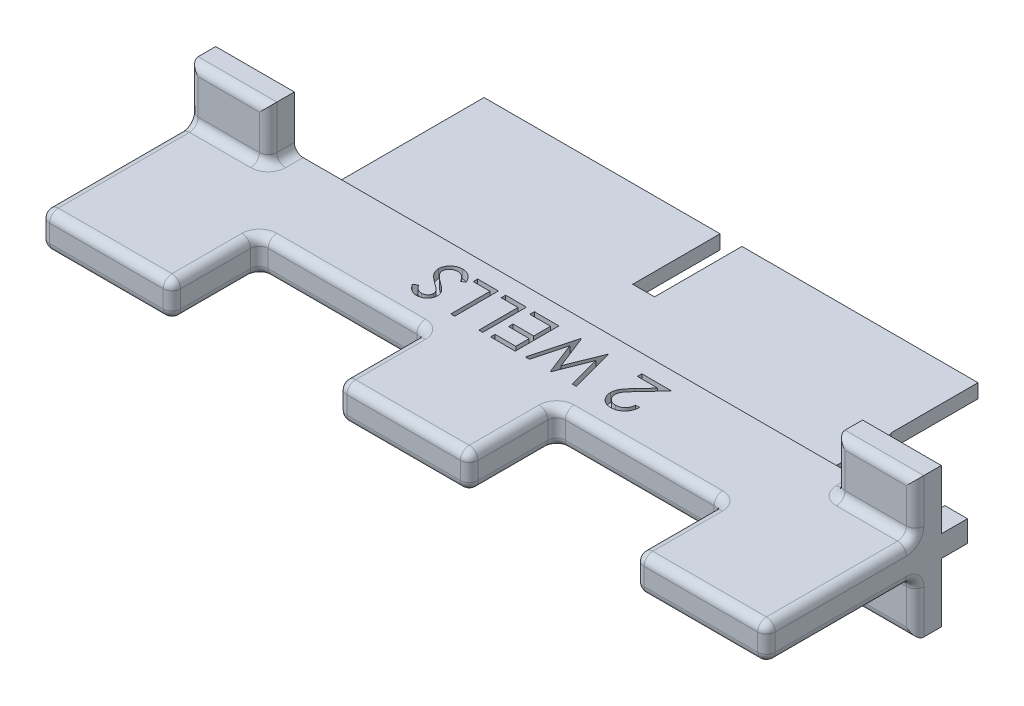
from build123d import *

# Parameters (mm, degrees)
SKETCH1_W           = 83
SKETCH1_H           = 4
BOSS_EXTRUDE1_DEPTH = 10
SKETCH2_W           = 15
SKETCH2_H           = 4
BOSS_EXTRUDE2_DEPTH = 10
SKETCH3_W           = 2.6
SKETCH3_H           = 2.45
BOSS_EXTRUDE3_DEPTH = 3
SKETCH4_W           = 56.6
SKETCH4_H           = 1.6
BOSS_EXTRUDE4_DEPTH = 7.5
SKETCH5_W           = 27
SKETCH5_H           = 1.6
BOSS_EXTRUDE5_DEPTH = 10
SKETCH6_W           = 9
SKETCH6_H           = 6
BOSS_EXTRUDE6_DEPTH = 3
FILLET1_R           = 1
CUT_EXTRUDE1_DEPTH  = 1


with BuildPart() as part:
    # Sketch1 → Boss-Extrude1 (new body)
    with BuildSketch(Plane.XY):
        Rectangle(SKETCH1_W, SKETCH1_H)
    extrude(amount=BOSS_EXTRUDE1_DEPTH)

    # Sketch2 → Boss-Extrude2 (add)
    with BuildSketch(Plane.XY.offset(10)):
        with Locations((-34, 0)):
            Rectangle(SKETCH2_W, SKETCH2_H)
        with Locations((34, 0)):
            Rectangle(SKETCH2_W, SKETCH2_H)
        Rectangle(SKETCH2_W, SKETCH2_H)
    extrude(amount=BOSS_EXTRUDE2_DEPTH)

    # Sketch3 → Boss-Extrude3 (add)
    with BuildSketch(Plane(origin=(0, 0, 0), x_dir=(-1, 0, 0), z_dir=(0, 0, -1))):
        with Locations((40.2, 0)):
            Rectangle(SKETCH3_W, SKETCH3_H)
        with Locations((-40.2, 0)):
            Rectangle(SKETCH3_W, SKETCH3_H)
    extrude(amount=BOSS_EXTRUDE3_DEPTH)

    # Sketch4 → Boss-Extrude4 (add)
    with BuildSketch(Plane(origin=(0, 0, 0), x_dir=(-1, 0, 0), z_dir=(0, 0, -1))):
        Rectangle(SKETCH4_W, SKETCH4_H)
    extrude(amount=BOSS_EXTRUDE4_DEPTH)

    # Sketch5 → Boss-Extrude5 (add)
    with BuildSketch(Plane(origin=(0, 0, -7.5), x_dir=(-1, 0, 0), z_dir=(0, 0, -1))):
        with Locations((14.8, 0)):
            Rectangle(SKETCH5_W, SKETCH5_H)
        with Locations((-14.7, 0)):
            Rectangle(SKETCH5_W, SKETCH5_H)
    extrude(amount=BOSS_EXTRUDE5_DEPTH)

    # Sketch6 → Boss-Extrude6 (add)
    with BuildSketch(Plane(origin=(0, 0, 0), x_dir=(-1, 0, 0), z_dir=(0, 0, -1))):
        with Locations((37, -5)):
            Rectangle(SKETCH6_W, SKETCH6_H)
        with Locations((37, 5)):
            Rectangle(SKETCH6_W, SKETCH6_H)
        with Locations((-37, -5)):
            Rectangle(SKETCH6_W, SKETCH6_H)
        with Locations((-37, 5)):
            Rectangle(SKETCH6_W, SKETCH6_H)
    extrude(amount=-BOSS_EXTRUDE6_DEPTH)

    # Fillet1
    fillet1_edges = [part.edges().sort_by_distance(p)[0] for p in [
        (-41.5, -2, 11.5),
        (-32.5, -2, 1.5),
        (-37, -2, 3),
        (-32.5, -5, 3),
        (-37, -8, 3),
        (-41.5, -5, 3),
        (-26.5, 0, 20),
        (-34, -2, 20),
        (-41.5, 0, 20),
        (-34, 2, 20),
        (32.5, -2, 1.5),
        (41.5, -2, 11.5),
        (41.5, 2, 11.5),
        (32.5, 2, 1.5),
        (-32.5, 2, 1.5),
        (-41.5, 2, 11.5),
        (37, -8, 3),
        (32.5, -5, 3),
        (37, -2, 3),
        (41.5, -5, 3),
        (34, -2, 20),
        (26.5, 0, 20),
        (34, 2, 20),
        (41.5, 0, 20),
        (37, 2, 3),
        (32.5, 5, 3),
        (37, 8, 3),
        (41.5, 5, 3),
        (0, -2, 20),
        (-7.5, 0, 20),
        (0, 2, 20),
        (7.5, 0, 20),
        (-37, 8, 3),
        (-32.5, 5, 3),
        (-37, 2, 3),
        (-41.5, 5, 3),
        (26.5, 2, 15),
        (26.5, -2, 15),
        (26.5, 0, 10),
        (17, -2, 10),
        (17, 2, 10),
        (7.5, -2, 15),
        (7.5, 2, 15),
        (7.5, 0, 10),
        (-7.5, 2, 15),
        (-7.5, -2, 15),
        (-26.5, -2, 15),
        (-26.5, 2, 15),
        (-26.5, 0, 10),
        (-17, 2, 10),
        (-7.5, 0, 10),
        (-17, -2, 10),
    ]]
    fillet(fillet1_edges, radius=FILLET1_R)

    # Sketch8 → Cut-Extrude1 (cut)
    with BuildSketch(Plane(origin=(0, 2, 0), x_dir=(1, 0, 0), z_dir=(0, 1, 0))):
        with BuildLine():
            Line((12.051282051, -5.506562595), (12.5, -5.506562595))
            add(Edge.make_bspline(
                [(12.5, -5.506562595), (12.497075993, -5.566092728), (12.491333323, -5.683008325), (12.464428723, -5.853466896), (12.425967248, -6.016417351), (12.371458365, -6.170462688), (12.304144659, -6.317443109), (12.221733202, -6.455406883), (12.125980874, -6.585723285), (12.017063336, -6.705924992), (11.898877769, -6.815804382), (11.772132288, -6.911694974), (11.638129598, -6.99178619), (11.49803198, -7.059104705), (11.350219164, -7.109574069), (11.196104075, -7.147037958), (11.034990128, -7.169574394), (10.925218792, -7.17199711), (10.869391026, -7.173229261)],
                knots=[0, 0, 0, 0, 1.100776268, 2.161895295, 3.184016182, 4.190939212, 5.176500551, 6.166955529, 7.155448256, 8.160289653, 9.16017456, 10.133824356, 11.091467644, 12.04088621, 13.000931625, 13.972173743, 14.968683325, 16, 16, 16, 16], degree=3))
            add(Edge.make_bspline(
                [(10.869391026, -7.173229261), (10.814561347, -7.171956168), (10.706822988, -7.169454585), (10.54964612, -7.147648624), (10.399661693, -7.114232934), (10.258569478, -7.064716144), (10.124921472, -7.002583404), (10.000372461, -6.925313202), (9.881910718, -6.836561703), (9.77535014, -6.731874959), (9.677461393, -6.620173937), (9.593087212, -6.500878186), (9.520423504, -6.377522706), (9.460950528, -6.249143911), (9.415867368, -6.115323738), (9.382465067, -5.977345167), (9.363370506, -5.83361583), (9.360456075, -5.736317952), (9.358974359, -5.686851056)],
                knots=[0, 0, 0, 0, 1.111674182, 2.184400057, 3.212814286, 4.223731311, 5.211378316, 6.196328225, 7.191884489, 8.207283132, 9.220262353, 10.201199469, 11.166417575, 12.120932471, 13.06540007, 14.026332106, 14.996573967, 16, 16, 16, 16], degree=3))
            add(Edge.make_bspline(
                [(9.358974359, -5.686851056), (9.361393344, -5.617211323), (9.366188864, -5.479153934), (9.407208845, -5.276275119), (9.47127741, -5.079714765), (9.548409655, -4.921513227), (9.626242733, -4.794048875), (9.696311485, -4.68904921), (9.778805044, -4.576022551), (9.873018621, -4.454511424), (9.980574708, -4.326107119), (10.098679011, -4.188189845), (10.230381616, -4.043309786), (10.322736804, -3.944290287), (10.370592949, -3.892980864)],
                knots=[0, 0, 0, 0, 1.184416499, 2.348048165, 3.509039915, 4.696071444, 5.333504901, 6.05069495, 6.844171097, 7.714965912, 8.667477798, 9.695072654, 10.805644396, 12, 12, 12, 12], degree=3))
            Line((10.370592949, -3.892980864), (11.621594551, -2.557844646))
            Line((11.621594551, -2.557844646), (9.294871795, -2.557844646))
            Line((9.294871795, -2.557844646), (9.294871795, -2.045024133))
            Line((9.294871795, -2.045024133), (12.692307692, -2.045024133))
            Line((12.692307692, -2.045024133), (10.753205128, -4.114335031))
            add(Edge.make_bspline(
                [(10.753205128, -4.114335031), (10.705990519, -4.163615638), (10.615300917, -4.258273598), (10.487084069, -4.396513192), (10.371739484, -4.524609386), (10.269190649, -4.643129805), (10.179353186, -4.75140255), (10.102514536, -4.850276128), (10.038335085, -4.938902036), (9.970318242, -5.043016046), (9.905459668, -5.170283947), (9.848455618, -5.325029653), (9.813946142, -5.4846805), (9.809785265, -5.592535144), (9.807692308, -5.646786954)],
                knots=[0, 0, 0, 0, 1.329530082, 2.553755191, 3.672934919, 4.687409497, 5.60679272, 6.413407421, 7.126401618, 7.737995624, 8.834647426, 9.90044882, 10.943907757, 12, 12, 12, 12], degree=3))
            add(Edge.make_bspline(
                [(9.807692308, -5.646786954), (9.808591182, -5.680907007), (9.81036269, -5.748151081), (9.826293256, -5.846676643), (9.849698419, -5.942084544), (9.885773005, -6.033195133), (9.929115292, -6.121800379), (9.984488259, -6.205206405), (10.047765021, -6.286256324), (10.12116296, -6.362171001), (10.201740259, -6.431720633), (10.286877666, -6.493325149), (10.376948522, -6.544809938), (10.471577461, -6.587014841), (10.570499508, -6.620122554), (10.673906301, -6.643063375), (10.781512034, -6.657466925), (10.854988457, -6.659415742), (10.892427885, -6.660408749)],
                knots=[0, 0, 0, 0, 0.991504627, 1.954065223, 2.895985987, 3.842598665, 4.797835564, 5.759220273, 6.74786863, 7.784730864, 8.824135544, 9.839918996, 10.835834653, 11.835434876, 12.84861661, 13.863796685, 14.911511676, 16, 16, 16, 16], degree=3))
            add(Edge.make_bspline(
                [(10.892427885, -6.660408749), (10.931539062, -6.65942789), (11.008346957, -6.657501645), (11.120875621, -6.6429023), (11.22897565, -6.620792336), (11.330981254, -6.585593456), (11.429027228, -6.544397764), (11.52061237, -6.49105659), (11.608309421, -6.43010605), (11.690355206, -6.359041592), (11.765081187, -6.278820522), (11.833060081, -6.191501306), (11.890659272, -6.095535949), (11.941789492, -5.993227169), (11.980894016, -5.881764121), (12.014325582, -5.76387277), (12.038609786, -5.637871084), (12.046987805, -5.551059058), (12.051282051, -5.506562595)],
                knots=[0, 0, 0, 0, 1.031072318, 2.024855787, 2.988461151, 3.935103592, 4.865765533, 5.788564469, 6.724086513, 7.67908574, 8.64457978, 9.611397706, 10.591395687, 11.591555111, 12.622101007, 13.700900657, 14.821571223, 16, 16, 16, 16], degree=3))
        make_face()
        Polygon((6.794871795, -7.045024133), (6.331129808, -7.045024133), (5.352564103, -3.378157146), (3.897235577, -7.045024133), (3.83213141, -7.045024133), (2.403846154, -3.40319721), (1.420272436, -7.045024133), (0.961538462, -7.045024133), (2.309695513, -2.045024133), (2.373798077, -2.045024133), (3.878205128, -5.869142723), (5.400641026, -2.045024133), (5.46474359, -2.045024133), align=None)
        Polygon((-0.192307692, -7.045024133), (-3.012820513, -7.045024133), (-3.012820513, -6.53220362), (-0.641025641, -6.53220362), (-0.641025641, -4.993742082), (-3.012820513, -4.993742082), (-3.012820513, -4.480921569), (-0.641025641, -4.480921569), (-0.641025641, -2.557844646), (-3.012820513, -2.557844646), (-3.012820513, -2.045024133), (-0.192307692, -2.045024133), align=None)
        Polygon((-3.91025641, -7.045024133), (-4.358974359, -7.045024133), (-4.358974359, -2.557844646), (-6.282051282, -2.557844646), (-6.282051282, -2.045024133), (-3.91025641, -2.045024133), align=None)
        Polygon((-7.115384615, -7.045024133), (-7.564102564, -7.045024133), (-7.564102564, -2.557844646), (-9.487179487, -2.557844646), (-9.487179487, -2.045024133), (-7.115384615, -2.045024133), align=None)
        with BuildLine():
            Line((-9.807692308, -3.009567402), (-10.23036859, -3.262972851))
            add(Edge.make_bspline(
                [(-10.23036859, -3.262972851), (-10.269680357, -3.197166587), (-10.345000187, -3.071084324), (-10.470644986, -2.900715695), (-10.600834859, -2.755912614), (-10.736533907, -2.63751746), (-10.876913832, -2.544304765), (-11.022891052, -2.478301577), (-11.173973639, -2.437135898), (-11.276793384, -2.432135774), (-11.328125, -2.429639518)],
                knots=[0, 0, 0, 0, 1.272034388, 2.437168799, 3.508375237, 4.49857839, 5.41946034, 6.295179144, 7.148887113, 8, 8, 8, 8], degree=3))
            add(Edge.make_bspline(
                [(-11.328125, -2.429639518), (-11.371954502, -2.430889524), (-11.458846592, -2.433367665), (-11.587016381, -2.456217403), (-11.710872361, -2.493599407), (-11.829181822, -2.544275191), (-11.938815817, -2.606565217), (-12.036480966, -2.680022202), (-12.119001238, -2.764880154), (-12.187223121, -2.858079446), (-12.240628341, -2.957674629), (-12.278627427, -3.061212939), (-12.303037216, -3.168034604), (-12.306132027, -3.240474158), (-12.307692308, -3.276995287)],
                knots=[0, 0, 0, 0, 1.095645842, 2.172120455, 3.244862764, 4.326153987, 5.384857088, 6.392105572, 7.372507978, 8.334705661, 9.272564127, 10.189475455, 11.087205874, 12, 12, 12, 12], degree=3))
            add(Edge.make_bspline(
                [(-12.307692308, -3.276995287), (-12.305631385, -3.318638967), (-12.301457793, -3.40297196), (-12.264675644, -3.52760827), (-12.208510842, -3.65148293), (-12.15572224, -3.72812182), (-12.128405449, -3.767780543)],
                knots=[0, 0, 0, 0, 0.938992559, 1.901562324, 2.914110574, 4, 4, 4, 4], degree=3))
            add(Edge.make_bspline(
                [(-12.128405449, -3.767780543), (-12.106085523, -3.796481036), (-12.059090087, -3.856910995), (-11.977108275, -3.94528344), (-11.883889791, -4.03885355), (-11.777021172, -4.13575368), (-11.658060793, -4.237965999), (-11.525659978, -4.343594856), (-11.381364713, -4.454215663), (-11.27958906, -4.527277526), (-11.226963141, -4.565056185)],
                knots=[0, 0, 0, 0, 0.722283655, 1.520795216, 2.39349503, 3.346893347, 4.386874146, 5.510198126, 6.712579003, 8, 8, 8, 8], degree=3))
            add(Edge.make_bspline(
                [(-11.226963141, -4.565056185), (-11.174364449, -4.602534172), (-11.073799756, -4.674189229), (-10.933053922, -4.780398761), (-10.807364907, -4.878123265), (-10.696092265, -4.966001475), (-10.60211476, -5.047866194), (-10.521996835, -5.119329929), (-10.458694345, -5.184208764), (-10.423468003, -5.226263007), (-10.407652244, -5.245144326)],
                knots=[0, 0, 0, 0, 1.452255772, 2.776602448, 3.96446981, 5.032613149, 5.964194703, 6.766668629, 7.446264616, 8, 8, 8, 8], degree=3))
            add(Edge.make_bspline(
                [(-10.407652244, -5.245144326), (-10.385552312, -5.274575839), (-10.342089832, -5.332456861), (-10.284657031, -5.422900125), (-10.236223793, -5.51530739), (-10.197244092, -5.610013561), (-10.165722685, -5.706306865), (-10.143807221, -5.804910234), (-10.130298992, -5.905154288), (-10.12890363, -5.972599812), (-10.128205128, -6.006362274)],
                knots=[0, 0, 0, 0, 1.068019517, 2.100403715, 3.106014851, 4.09224787, 5.069873182, 6.043214339, 7.020455327, 8, 8, 8, 8], degree=3))
            add(Edge.make_bspline(
                [(-10.128205128, -6.006362274), (-10.130061496, -6.059266485), (-10.133734553, -6.163944115), (-10.165054501, -6.316779541), (-10.213905187, -6.463148887), (-10.284580931, -6.599794501), (-10.371878698, -6.726522677), (-10.475501314, -6.841085368), (-10.597389337, -6.939539184), (-10.733081834, -7.023232798), (-10.879873148, -7.090001634), (-11.034142211, -7.138653592), (-11.195195819, -7.167166609), (-11.304642448, -7.171188521), (-11.360176282, -7.173229261)],
                knots=[0, 0, 0, 0, 1.005367131, 1.989245246, 2.955191616, 3.932180104, 4.904534562, 5.875498653, 6.859376768, 7.874484044, 8.900379497, 9.918679785, 10.943926428, 12, 12, 12, 12], degree=3))
            add(Edge.make_bspline(
                [(-11.360176282, -7.173229261), (-11.419114634, -7.171262547), (-11.535996434, -7.167362316), (-11.707974325, -7.131365167), (-11.874542669, -7.075434995), (-12.008034124, -7.008823238), (-12.112549287, -6.943010929), (-12.192169521, -6.882914417), (-12.273293038, -6.813878112), (-12.355045765, -6.734439505), (-12.438235438, -6.646189546), (-12.522478669, -6.548380569), (-12.608563888, -6.441894176), (-12.663926291, -6.365855922), (-12.692307692, -6.326875095)],
                knots=[0, 0, 0, 0, 1.286534051, 2.551350862, 3.822568981, 5.117864672, 5.799956111, 6.519305446, 7.295594771, 8.126302591, 9.008831062, 9.944975596, 10.946496709, 12, 12, 12, 12], degree=3))
            Line((-12.692307692, -6.326875095), (-12.286658654, -6.019383108))
            add(Edge.make_bspline(
                [(-12.286658654, -6.019383108), (-12.262166251, -6.050940207), (-12.214999609, -6.111711801), (-12.143362298, -6.196789377), (-12.075944738, -6.274609563), (-12.009013791, -6.342024516), (-11.947728709, -6.404083282), (-11.887190861, -6.45627091), (-11.829738911, -6.500244196), (-11.757486688, -6.547233413), (-11.66572616, -6.592695827), (-11.551613284, -6.631782667), (-11.432283383, -6.655803848), (-11.351272947, -6.658856909), (-11.310096154, -6.660408749)],
                knots=[0, 0, 0, 0, 1.181426797, 2.275151783, 3.28963443, 4.225459815, 5.084396437, 5.868484344, 6.587427557, 7.222918358, 8.415355282, 9.605213164, 10.782753814, 12, 12, 12, 12], degree=3))
            add(Edge.make_bspline(
                [(-11.310096154, -6.660408749), (-11.25843179, -6.658706093), (-11.158801931, -6.655422682), (-11.017686229, -6.618619291), (-10.889941304, -6.562662214), (-10.780443797, -6.481972694), (-10.690033403, -6.385775243), (-10.623822408, -6.276068826), (-10.584236018, -6.154902356), (-10.579390713, -6.07042095), (-10.576923077, -6.027395928)],
                knots=[0, 0, 0, 0, 1.144248881, 2.206576175, 3.214949548, 4.222996039, 5.203671638, 6.127710127, 7.046472867, 8, 8, 8, 8], degree=3))
            add(Edge.make_bspline(
                [(-10.576923077, -6.027395928), (-10.577543308, -6.000621284), (-10.578792412, -5.946699014), (-10.593684755, -5.867196304), (-10.615908455, -5.788629526), (-10.647409936, -5.710546018), (-10.690220821, -5.630721251), (-10.748365519, -5.549610209), (-10.821125909, -5.465182894), (-10.876967593, -5.410325386), (-10.906450321, -5.381362274)],
                knots=[0, 0, 0, 0, 0.858500039, 1.728959331, 2.587258638, 3.476905708, 4.426389682, 5.487945037, 6.673710648, 8, 8, 8, 8], degree=3))
            add(Edge.make_bspline(
                [(-10.906450321, -5.381362274), (-10.917395138, -5.371595095), (-10.94339752, -5.348390511), (-10.990934557, -5.310401539), (-11.053709983, -5.263540436), (-11.130084556, -5.205558555), (-11.221466501, -5.138299323), (-11.327865867, -5.062622734), (-11.448096628, -4.976072079), (-11.533413651, -4.915561306), (-11.578525641, -4.8835658)],
                knots=[0, 0, 0, 0, 0.420754252, 0.999615792, 1.744751191, 2.668019286, 3.750313428, 4.999500688, 6.413464383, 8, 8, 8, 8], degree=3))
            add(Edge.make_bspline(
                [(-11.578525641, -4.8835658), (-11.632791193, -4.844078115), (-11.737868914, -4.767615687), (-11.88738026, -4.652736522), (-12.02294107, -4.540381275), (-12.145037317, -4.431274748), (-12.254841634, -4.32622016), (-12.351247129, -4.224035058), (-12.434691218, -4.125389559), (-12.525751578, -3.99977991), (-12.617695548, -3.844082152), (-12.696529945, -3.653237045), (-12.746683039, -3.461844272), (-12.753196542, -3.333371554), (-12.756410256, -3.269984069)],
                knots=[0, 0, 0, 0, 1.163604038, 2.253157948, 3.268574773, 4.215621239, 5.091738613, 5.902582348, 6.650434646, 7.330118262, 8.591011492, 9.77460283, 10.902005569, 12, 12, 12, 12], degree=3))
            add(Edge.make_bspline(
                [(-12.756410256, -3.269984069), (-12.755470009, -3.225158662), (-12.753607773, -3.136378326), (-12.732256542, -3.006001884), (-12.700862764, -2.879431158), (-12.654074114, -2.758241266), (-12.595586942, -2.641081534), (-12.524379279, -2.528157389), (-12.438083699, -2.421324295), (-12.342219663, -2.318507524), (-12.235738973, -2.225519919), (-12.123060663, -2.142697321), (-12.004817169, -2.071782763), (-11.879658172, -2.016070712), (-11.749645381, -1.971505835), (-11.614168507, -1.939562904), (-11.472936436, -1.919891418), (-11.37693436, -1.917854576), (-11.328125, -1.916819005)],
                knots=[0, 0, 0, 0, 0.98378539, 1.948466333, 2.894822735, 3.844243623, 4.795447569, 5.768042124, 6.770299647, 7.807997672, 8.852593179, 9.870666288, 10.876941106, 11.874841786, 12.874492863, 13.892063892, 14.928283473, 16, 16, 16, 16], degree=3))
            add(Edge.make_bspline(
                [(-11.328125, -1.916819005), (-11.290361891, -1.917557632), (-11.215311261, -1.919025584), (-11.104600263, -1.931695771), (-10.995922262, -1.95027676), (-10.890641808, -1.978606014), (-10.787448091, -2.013786535), (-10.687260491, -2.056859669), (-10.589837326, -2.108137258), (-10.495058251, -2.167698619), (-10.40205577, -2.236358883), (-10.311205228, -2.315634394), (-10.222051831, -2.40514569), (-10.134225246, -2.504768208), (-10.04979434, -2.616148638), (-9.966635927, -2.737520615), (-9.885183017, -2.869276248), (-9.834004999, -2.961930236), (-9.807692308, -3.009567402)],
                knots=[0, 0, 0, 0, 0.915366252, 1.81920441, 2.69897508, 3.586533125, 4.459536084, 5.340758185, 6.227946952, 7.126403341, 8.052553006, 9.028121456, 10.047063623, 11.114014537, 12.24582441, 13.433687931, 14.680555077, 16, 16, 16, 16], degree=3))
        make_face()
    extrude(amount=-CUT_EXTRUDE1_DEPTH, mode=Mode.SUBTRACT)


solid = part.part
